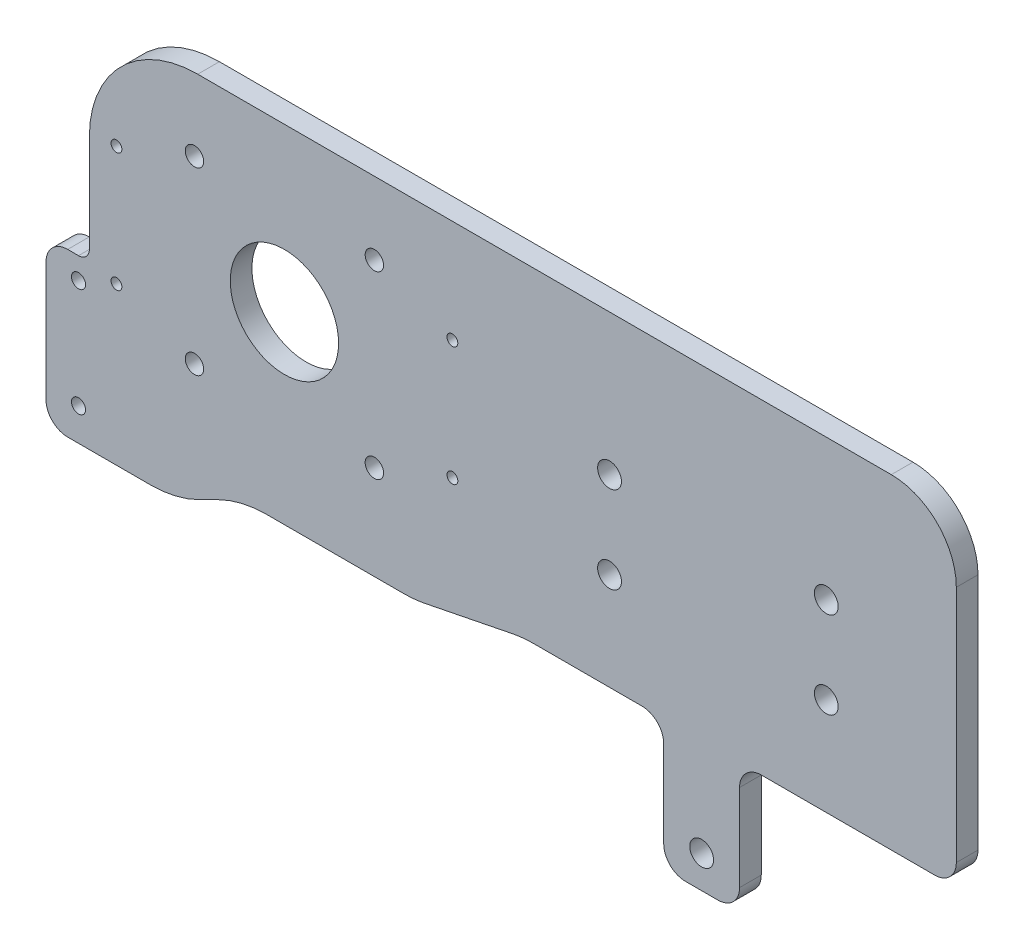
from build123d import *

# Parameters (mm, degrees)
TABAN_FLAN_1_DEPTH    = 10
IZIM2_R               = 25
IZIM2_R_2             = 4.25
IZIM2_R_3             = 5.5
IZIM2_R_4             = 3.25
KES_EKSTR_ZYON1_DEPTH = 10
RADYUS2_R             = 50
RADYUS3_R             = 30
RADYUS4_R             = 10
RADYUS5_R             = 50
RADYUS6_R             = 10
RADYUS7_R             = 5
IZIM3_R               = 2.5
KES_EKSTR_ZYON2_DEPTH = 29


# Sheet-metal steps are written as plain solids
with BuildPart() as part:
    # Çizim1 → Taban-Flanş1 (new body)
    with BuildSketch(Plane.XY):
        Polygon((0, 120), (-400, 120), (-400, 20), (-420, 20), (-420, -55), (-360, -55), (-330, -40), (-250, -40), (-200, -30), (-135, -30), (-135, -90), (-100, -90), (-100, -30), (0, -30), (0, 0), align=None)
    extrude(amount=-TABAN_FLAN_1_DEPTH)

    # Çizim2 → Kes-Ekstrüzyon1 (cut)
    with BuildSketch(Plane.XY):
        with Locations((-310, 45)):
            Circle(IZIM2_R)
        with Locations((-351.5, 86.5)):
            Circle(IZIM2_R_2)
        with Locations((-268.5, 86.5)):
            Circle(IZIM2_R_2)
        with Locations((-351.5, 3.5)):
            Circle(IZIM2_R_2)
        with Locations((-268.5, 3.5)):
            Circle(IZIM2_R_2)
        with Locations((-60, 55)):
            Circle(IZIM2_R_3)
        with Locations((-160, 55)):
            Circle(IZIM2_R_3)
        with Locations((-160, 15)):
            Circle(IZIM2_R_3)
        with Locations((-60, 15)):
            Circle(IZIM2_R_3)
        with Locations((-117.5, -75)):
            Circle(IZIM2_R_3)
        with Locations((-405, 10)):
            Circle(IZIM2_R_4)
        with Locations((-405, -40)):
            Circle(IZIM2_R_4)
    extrude(amount=-KES_EKSTR_ZYON1_DEPTH, mode=Mode.SUBTRACT)

    # Radyus2
    radyus2_edges = [part.edges().sort_by_distance(p)[0] for p in [
        (-400, 120, -5),
    ]]
    fillet(radyus2_edges, radius=RADYUS2_R)

    # Radyus3
    radyus3_edges = [part.edges().sort_by_distance(p)[0] for p in [
        (0, 120, -5),
    ]]
    fillet(radyus3_edges, radius=RADYUS3_R)

    # Radyus4
    radyus4_edges = [part.edges().sort_by_distance(p)[0] for p in [
        (0, -30, -5),
        (-100, -30, -5),
        (-100, -90, -5),
        (-135, -90, -5),
        (-135, -30, -5),
    ]]
    fillet(radyus4_edges, radius=RADYUS4_R)

    # Radyus5
    radyus5_edges = [part.edges().sort_by_distance(p)[0] for p in [
        (-200, -30, -5),
        (-250, -40, -5),
        (-330, -40, -5),
        (-360, -55, -5),
    ]]
    fillet(radyus5_edges, radius=RADYUS5_R)

    # Radyus6
    radyus6_edges = [part.edges().sort_by_distance(p)[0] for p in [
        (-420, -55, -5),
        (-420, 20, -5),
    ]]
    fillet(radyus6_edges, radius=RADYUS6_R)

    # Radyus7
    radyus7_edges = [part.edges().sort_by_distance(p)[0] for p in [
        (-400, 20, -5),
    ]]
    fillet(radyus7_edges, radius=RADYUS7_R)

    # Çizim3 → Kes-Ekstrüzyon2 (cut)
    with BuildSketch(Plane(origin=(0, 0, -10), x_dir=(-1, 0, 0), z_dir=(0, 0, -1))):
        with Locations((232.5, 72.5)):
            Circle(IZIM3_R)
        with Locations((232.5, 17.5)):
            Circle(IZIM3_R)
        with Locations((387.5, 17.5)):
            Circle(IZIM3_R)
        with Locations((387.5, 72.5)):
            Circle(IZIM3_R)
    extrude(amount=-KES_EKSTR_ZYON2_DEPTH, mode=Mode.SUBTRACT)


solid = part.part
